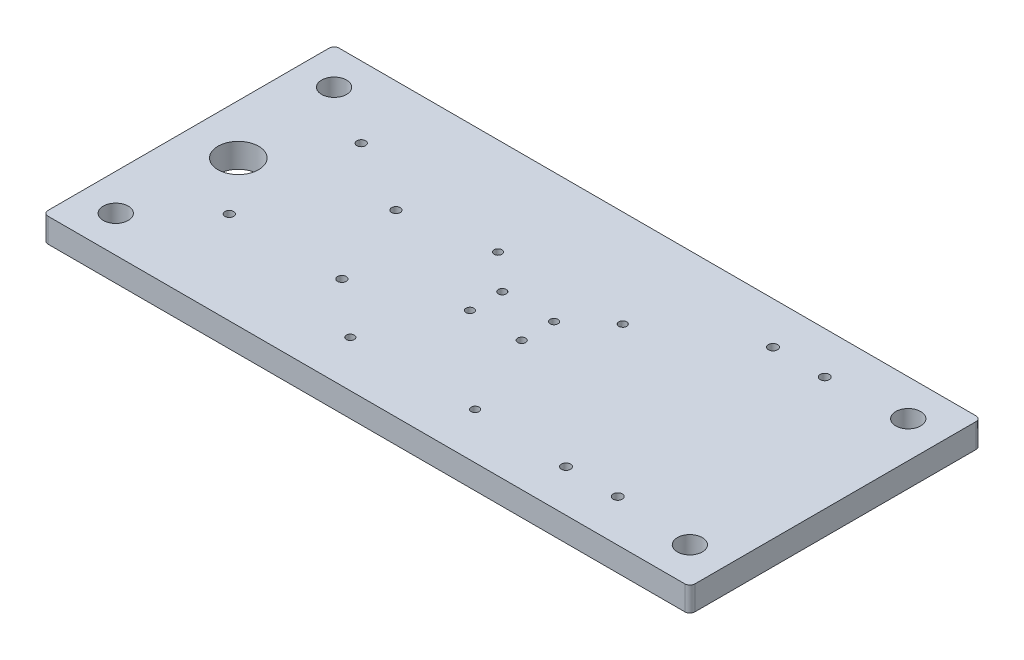
from build123d import *

# Parameters (mm, degrees)
SKETCH1_W                      = 254
SKETCH1_H                      = 114.3
BOSS_EXTRUDE1_DEPTH            = 9.525
F_3_8_CLEARANCE_HOLE1_D        = 9.8044
F_3_8_CLEARANCE_HOLE1_DEPTH    = 10
F_3_8_CLEARANCE_HOLE1_TIP      = 2.945538927
M2_5_CLEARANCE_HOLE3_D         = 3.1
M2_5_CLEARANCE_HOLE3_DEPTH     = 10
M2_5_CLEARANCE_HOLE3_TIP       = 0.931333959
FILLET1_R                      = 2
M3_CLEARANCE_HOLE4_D           = 3.4
M3_CLEARANCE_HOLE4_DEPTH       = 10
M3_CLEARANCE_HOLE4_TIP         = 1.021463052
SKETCH22_R                     = 8
CUT_EXTRUDE1_DEPTH             = 140.5917194
M3_CLEARANCE_HOLE5_D           = 3.6
M3_CLEARANCE_HOLE5_DEPTH       = 10
M3_CLEARANCE_HOLE5_TIP         = 1.081549114
M2_5_CLEARANCE_HOLE4_OUTLINE_R = 1.55
M2_5_CLEARANCE_HOLE4_DEPTH     = 9.525


# Read off the part's stored shape, not the designer's step: M2.5 Clearance Hole4
with BuildPart() as part:
    # Sketch1 → Boss-Extrude1 (new body)
    with BuildSketch(Plane(origin=(0, 0, 0), x_dir=(1, 0, 0), z_dir=(0, 1, 0))):
        Rectangle(SKETCH1_W, SKETCH1_H)
    extrude(amount=BOSS_EXTRUDE1_DEPTH)

    # 3/8 Clearance Hole1
    with Locations(Plane(origin=(0, 9.525, 0), x_dir=(1, 0, 0), z_dir=(0, 1, 0))):
        with Locations((112.7125, 42.8625), (112.7125, -42.8675), (-112.7175, 42.8625), (-112.7175, -42.8675)):
            Hole(F_3_8_CLEARANCE_HOLE1_D / 2, depth=F_3_8_CLEARANCE_HOLE1_DEPTH)
            with Locations((0, 0, -(F_3_8_CLEARANCE_HOLE1_DEPTH + F_3_8_CLEARANCE_HOLE1_TIP / 2))):  # 118° drill point
                Cone(0, F_3_8_CLEARANCE_HOLE1_D / 2, F_3_8_CLEARANCE_HOLE1_TIP, mode=Mode.SUBTRACT)

    # M2.5 Clearance Hole3
    with Locations(Plane(origin=(0, 9.525, 0), x_dir=(1, 0, 0), z_dir=(0, 1, 0))):
        with Locations((24.5, 19), (-24.5, -39), (24.5, -39), (-24.5, 19)):
            Hole(M2_5_CLEARANCE_HOLE3_D / 2, depth=M2_5_CLEARANCE_HOLE3_DEPTH)
            with Locations((0, 0, -(M2_5_CLEARANCE_HOLE3_DEPTH + M2_5_CLEARANCE_HOLE3_TIP / 2))):  # 118° drill point
                Cone(0, M2_5_CLEARANCE_HOLE3_D / 2, M2_5_CLEARANCE_HOLE3_TIP, mode=Mode.SUBTRACT)

    # Fillet1
    fillet1_edges = [part.edges().sort_by_distance(p)[0] for p in [
        (127, 4.7625, 57.15),
        (-127, 4.7625, 57.15),
        (-127, 4.7625, -57.15),
        (127, 4.7625, -57.15),
    ]]
    fillet(fillet1_edges, radius=FILLET1_R)

    # M3 Clearance Hole4
    with Locations(Plane(origin=(0, 9.525, 0), x_dir=(1, 0, 0), z_dir=(0, 1, 0))):
        with Locations((-90.2, -20.8), (-88.35, 29.15), (-58.8, 13.25), (-46, -20.8)):
            Hole(M3_CLEARANCE_HOLE4_D / 2, depth=M3_CLEARANCE_HOLE4_DEPTH)
            with Locations((0, 0, -(M3_CLEARANCE_HOLE4_DEPTH + M3_CLEARANCE_HOLE4_TIP / 2))):  # 118° drill point
                Cone(0, M3_CLEARANCE_HOLE4_D / 2, M3_CLEARANCE_HOLE4_TIP, mode=Mode.SUBTRACT)

    # Sketch22 → Cut-Extrude1 (cut, through all)
    with BuildSketch(Plane(origin=(0, 9.525, 0), x_dir=(1, 0, 0), z_dir=(0, 1, 0))):
        with Locations(Location((-107.475, 0, 0), (0, 0, 270))):
            Circle(SKETCH22_R)
    extrude(amount=-CUT_EXTRUDE1_DEPTH, mode=Mode.SUBTRACT)

    # M3 Clearance Hole5
    with Locations(Plane(origin=(0, 9.525, 0), x_dir=(1, 0, 0), z_dir=(0, 1, 0))):
        with Locations((61.84, 40.64), (61.84, -40.64), (82.16, -40.64), (82.16, 40.64)):
            Hole(M3_CLEARANCE_HOLE5_D / 2, depth=M3_CLEARANCE_HOLE5_DEPTH)
            with Locations((0, 0, -(M3_CLEARANCE_HOLE5_DEPTH + M3_CLEARANCE_HOLE5_TIP / 2))):  # 118° drill point
                Cone(0, M3_CLEARANCE_HOLE5_D / 2, M3_CLEARANCE_HOLE5_TIP, mode=Mode.SUBTRACT)

    # M2.5 Clearance Hole4 outline → M2.5 Clearance Hole4 (cut)
    with BuildSketch(Plane(origin=(0, 0, 0), x_dir=(1, 0, 0), z_dir=(0, 1, 0))):
        with Locations((-10.16, 6.35)):
            Circle(M2_5_CLEARANCE_HOLE4_OUTLINE_R)
        with Locations((10.16, 6.35)):
            Circle(M2_5_CLEARANCE_HOLE4_OUTLINE_R)
        with Locations((10.16, -6.35)):
            Circle(M2_5_CLEARANCE_HOLE4_OUTLINE_R)
        with Locations((-10.16, -6.35)):
            Circle(M2_5_CLEARANCE_HOLE4_OUTLINE_R)
    extrude(amount=M2_5_CLEARANCE_HOLE4_DEPTH, mode=Mode.SUBTRACT)


solid = part.part
